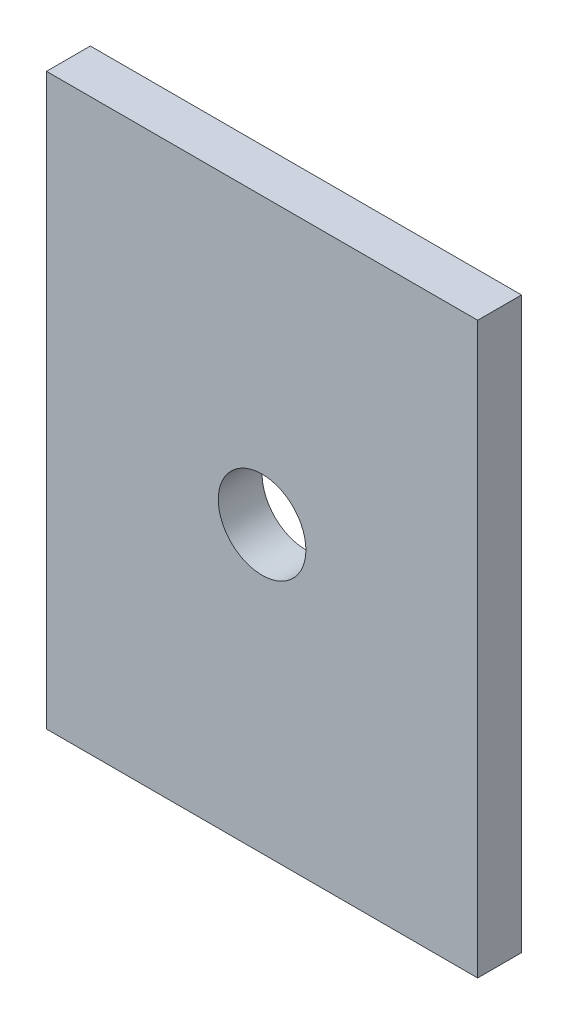
from build123d import *

# Parameters (mm, degrees)
SKETCH1_W           = 9.84
SKETCH1_H           = 13
BOSS_EXTRUDE1_DEPTH = 1
SKETCH2_R           = 1
CUT_EXTRUDE1_DEPTH  = 9.213184522


with BuildPart() as part:
    # Sketch1 → Boss-Extrude1 (new body)
    with BuildSketch(Plane.XY):
        Rectangle(SKETCH1_W, SKETCH1_H)
    extrude(amount=BOSS_EXTRUDE1_DEPTH)

    # Sketch2 → Cut-Extrude1 (cut, through all)
    with BuildSketch(Plane.XY.offset(1)):
        Circle(SKETCH2_R)
    extrude(amount=-CUT_EXTRUDE1_DEPTH, mode=Mode.SUBTRACT)


solid = part.part
